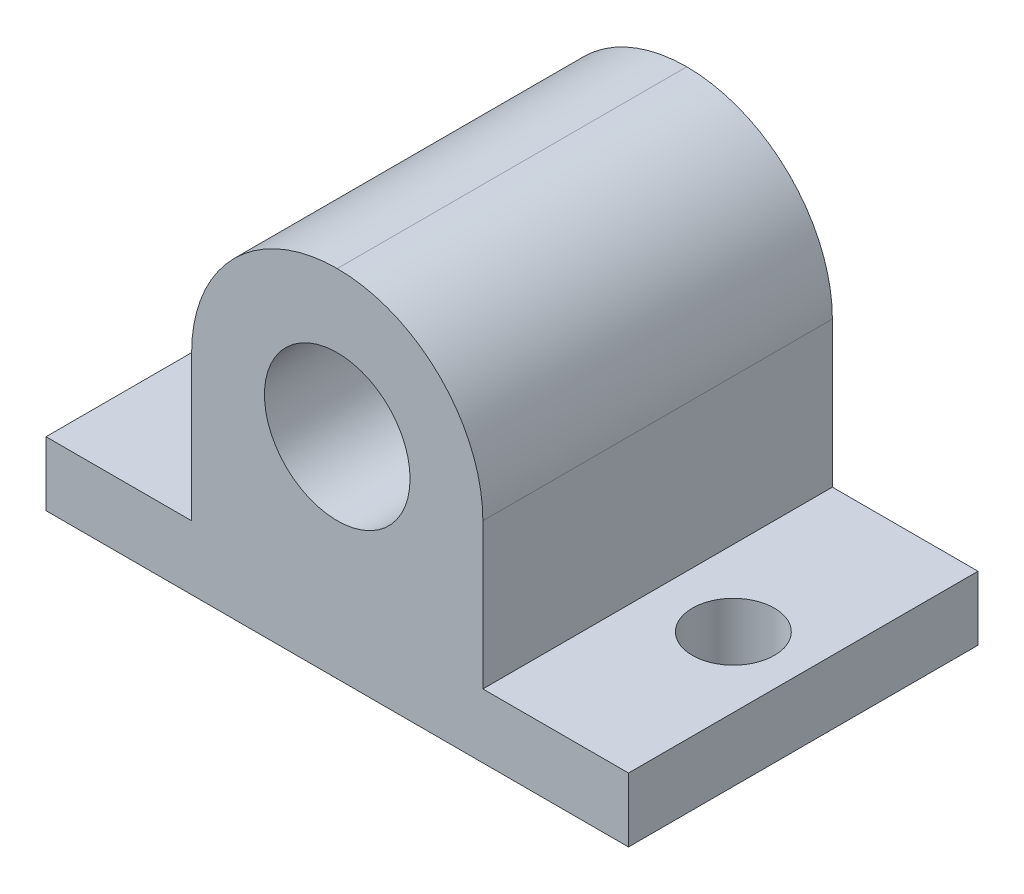
from build123d import *

# Parameters (mm, degrees)
SKETCH1_W           = 25.4
SKETCH1_H           = 15.24
BOSS_EXTRUDE1_DEPTH = 2.794
SKETCH2_W           = 12.7
SKETCH2_H           = 15.24
BOSS_EXTRUDE2_DEPTH = 12.7
FILLET1_R           = 6.35
SKETCH3_R           = 3.175
CUT_EXTRUDE1_DEPTH  = 34.428754628
SKETCH4_R           = 1.787540604
CUT_EXTRUDE2_DEPTH  = 33.228986953


with BuildPart() as part:
    # Sketch1 → Boss-Extrude1 (new body)
    with BuildSketch(Plane(origin=(0, 0, 0), x_dir=(1, 0, 0), z_dir=(0, 1, 0))):
        with Locations((12.7, 7.62)):
            Rectangle(SKETCH1_W, SKETCH1_H)
    extrude(amount=BOSS_EXTRUDE1_DEPTH)

    # Sketch2 → Boss-Extrude2 (add)
    with BuildSketch(Plane(origin=(0, 2.794, 0), x_dir=(1, 0, 0), z_dir=(0, 1, 0))):
        with Locations((12.7, 7.62)):
            Rectangle(SKETCH2_W, SKETCH2_H)
    extrude(amount=BOSS_EXTRUDE2_DEPTH)

    # Fillet1
    fillet1_edges = [part.edges().sort_by_distance(p)[0] for p in [
        (6.35, 15.494, -7.62),
        (19.05, 15.494, -7.62),
    ]]
    fillet(fillet1_edges, radius=FILLET1_R - 0.0001)  # a hair under: the kernel refuses the full size

    # Sketch3 → Cut-Extrude1 (cut, through all)
    with BuildSketch(Plane.XY):
        with Locations((12.7, 9.144)):
            Circle(SKETCH3_R)
    extrude(amount=-CUT_EXTRUDE1_DEPTH, mode=Mode.SUBTRACT)

    # Sketch4 → Cut-Extrude2 (cut, through all)
    with BuildSketch(Plane(origin=(0, 2.794, 0), x_dir=(1, 0, 0), z_dir=(0, 1, 0))):
        with Locations(Location((3.048, 7.62, 0), (0, 0, 270))):
            Circle(SKETCH4_R)
        with Locations(Location((22.352, 7.62, 0), (0, 0, 270))):
            Circle(SKETCH4_R)
    extrude(amount=-CUT_EXTRUDE2_DEPTH, mode=Mode.SUBTRACT)


solid = part.part
